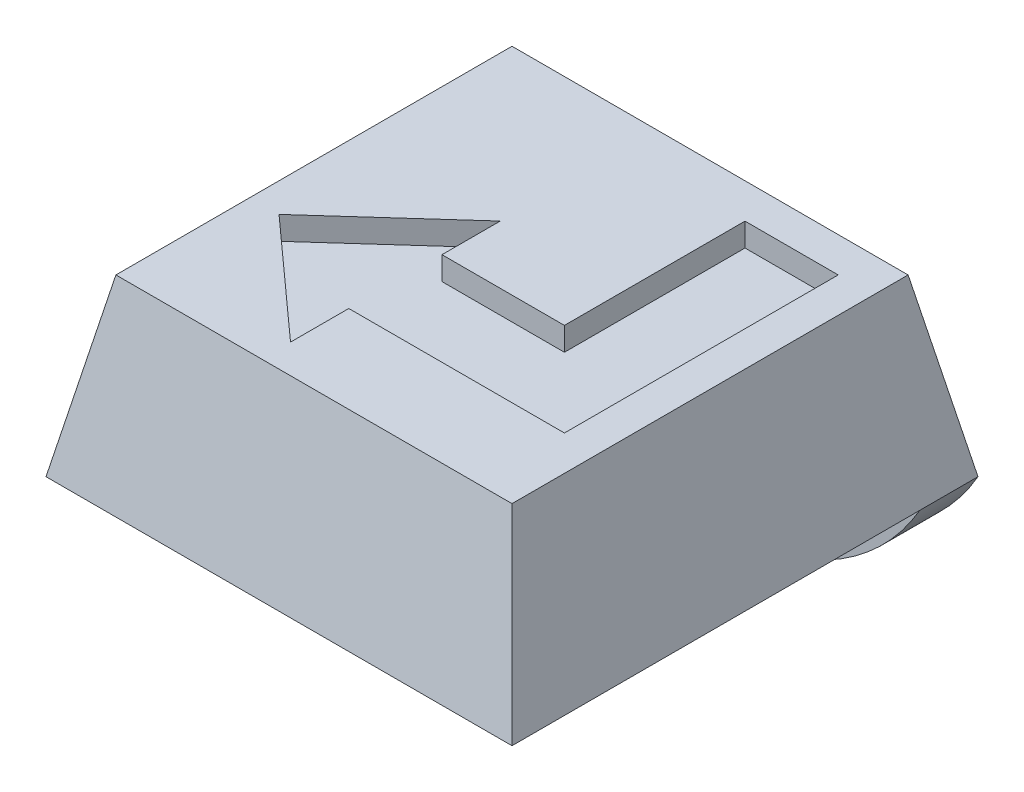
from build123d import *

# Parameters (mm, degrees)
SKETCH1_W               = 8
SKETCH1_H               = 8
BOSS_EXTRUDE1_DEPTH     = 3
CUT_EXTRUDE1_DEPTH      = 12.704699911
CUT_EXTRUDE1_DEPTH_BACK = 12.704699911
CUT_EXTRUDE2_DEPTH      = 11
SKETCH4_R               = 1.8
CUT_EXTRUDE3_DEPTH      = 0.8
SKETCH5_W               = 8
SKETCH5_H               = 1
BOSS_EXTRUDE2_DEPTH     = 2
FILLET1_R               = 4
SKETCH6_W               = 2.10217216
SKETCH6_H               = 1.6
CUT_EXTRUDE4_DEPTH      = 0.4


with BuildPart() as part:
    # Sketch1 → Boss-Extrude1 (new body)
    with BuildSketch(Plane(origin=(0, 0, 0), x_dir=(1, 0, 0), z_dir=(0, 1, 0))):
        with Locations((4, 4)):
            Rectangle(SKETCH1_W, SKETCH1_H)
    extrude(amount=BOSS_EXTRUDE1_DEPTH)

    # Sketch2 → Cut-Extrude1 (cut, two sides: drawn at the far end of the back side and taken through both)
    with BuildSketch(Plane.XY.offset(-CUT_EXTRUDE1_DEPTH_BACK)):
        Polygon((0, 0), (0.6, 3), (0, 3), align=None)
        Polygon((8, 0), (7.4, 3), (8, 3), align=None)
    extrude(amount=CUT_EXTRUDE1_DEPTH + CUT_EXTRUDE1_DEPTH_BACK, mode=Mode.SUBTRACT)

    # Sketch3 → Cut-Extrude2 (cut)
    with BuildSketch(Plane(origin=(0, 0, 0), x_dir=(0, 0, -1), z_dir=(1, 0, 0))):
        Polygon((0, 0), (0.6, 3), (0, 3), align=None)
        Polygon((8, 3), (7.4, 3), (8, 0), align=None)
    extrude(amount=CUT_EXTRUDE2_DEPTH, mode=Mode.SUBTRACT)

    # Sketch4 → Cut-Extrude3 (cut)
    with BuildSketch(Plane.XZ):
        with Locations(Location((4, -3.75, 0), (0, 0, 270))):
            Circle(SKETCH4_R)
    extrude(amount=-CUT_EXTRUDE3_DEPTH, mode=Mode.SUBTRACT)

    # Sketch5 → Boss-Extrude2 (add)
    with BuildSketch(Plane.XZ):
        with Locations((4, -7.5)):
            Rectangle(SKETCH5_W, SKETCH5_H)
    extrude(amount=BOSS_EXTRUDE2_DEPTH)

    # Fillet1
    # the kernel refuses this fillet: 4 mm, written as the material it takes off along each edge
    with BuildSketch(Plane(origin=(8, -2, -16.660254038), x_dir=(0, 1, 0), z_dir=(0, 0, 1)), Plane(origin=(0, -2, 1.660254038), x_dir=(0, 1, 0), z_dir=(0, 0, -1))) as fillet1_piece_1:
        with BuildLine():
            CenterArc((4, 3.464101615), FILLET1_R, 180, 60)
            Line((0, 3.464101615), (-0.08, 3.464101615))
            Line((-0.08, 3.464101615), (-0.08, 0))
            Line((-0.08, 0), (0, -0.08))
            ThreePointArc((0, -0.08), (1, -0.08), (1.96, -0.069282032))
            Line((1.96, -0.069282032), (2, 0))
        make_face()
    extrude(amount=18.320508076, mode=Mode.SUBTRACT)

    # Sketch6 → Cut-Extrude4 (cut)
    with BuildSketch(Plane(origin=(0, 3, 0), x_dir=(1, 0, 0), z_dir=(0, 1, 0))):
        Polygon((3.09782784, 2.1), (3.09782784, 3.7), (3.09782784, 4.7), (1.1, 2.9), (3.09782784, 1.1), align=None)
        with Locations((4.14891392, 2.9)):
            Rectangle(SKETCH6_W, SKETCH6_H)
        Polygon((5.2, 6.8), (5.2, 3.7), (5.2, 2.1), (6.8, 2.1), (6.8, 6.8), align=None)
    extrude(amount=-CUT_EXTRUDE4_DEPTH, mode=Mode.SUBTRACT)


solid = part.part
